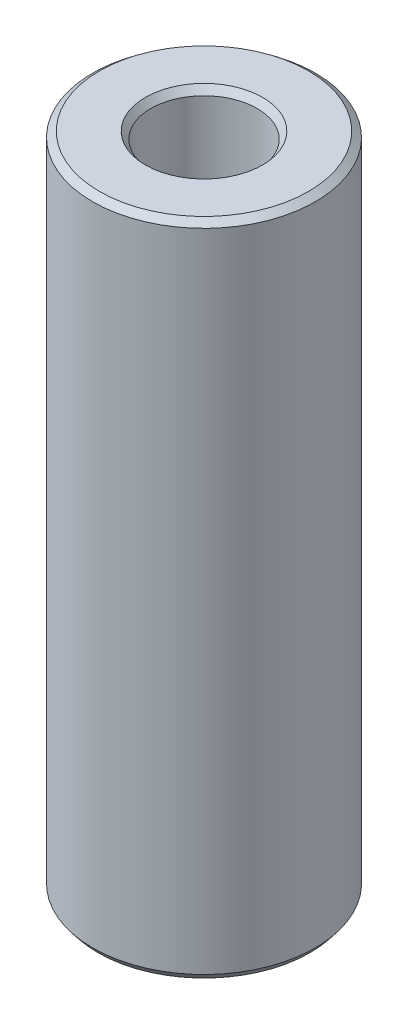
from build123d import *
from OCP.BRepFilletAPI import BRepFilletAPI_MakeChamfer

# Parameters (mm, degrees)
SKETCH1_R           = 57.5
BOSS_EXTRUDE1_DEPTH = 339.91790839
SKETCH2_R           = 27.460702614
CUT_EXTRUDE1_DEPTH  = 350.509205092
CHAMFER1_SIZE       = 2.786394633
CHAMFER1_SIZE2      = 3.574376344


with BuildPart() as part:
    # Sketch1 → Boss-Extrude1 (new body)
    with BuildSketch(Plane(origin=(0, 0, 0), x_dir=(1, 0, 0), z_dir=(0, 1, 0))):
        Circle(SKETCH1_R)
    extrude(amount=BOSS_EXTRUDE1_DEPTH)

    # Sketch2 → Cut-Extrude1 (cut, through all)
    with BuildSketch(Plane(origin=(0, 0, 0), x_dir=(1, 0, 0), z_dir=(0, 1, 0))):
        Circle(SKETCH2_R)
    extrude(amount=CUT_EXTRUDE1_DEPTH, mode=Mode.SUBTRACT)

    # Chamfer1: one chamfer whose edges measure the first distance from different faces: ONE call of the kernel's chamfer builder (chamfer() names one face for all edges)
    chamfer1_edges_1 = [part.edges().sort_by_distance(p)[0] for p in [
        (-27.460702614, 339.91790839, 0),
    ]]
    chamfer1_side_1 = [part.faces().sort_by_distance(p)[0] for p in [
        (-55.873654403, 339.91790839, 0),
    ]]
    chamfer1_edges_2 = [part.edges().sort_by_distance(p)[0] for p in [
        (-27.460702614, 0, 0),
    ]]
    chamfer1_side_2 = [part.faces().sort_by_distance(p)[0] for p in [
        (-27.460702614, 169.958954195, 0),
    ]]
    chamfer1_edges_3 = [part.edges().sort_by_distance(p)[0] for p in [
        (-57.5, 0, 0),
    ]]
    chamfer1_side_3 = [part.faces().sort_by_distance(p)[0] for p in [
        (-55.873654403, 0, 0),
    ]]
    chamfer1_edges_4 = [part.edges().sort_by_distance(p)[0] for p in [
        (-57.5, 339.91790839, 0),
    ]]
    chamfer1_side_4 = [part.faces().sort_by_distance(p)[0] for p in [
        (-57.5, 169.958954195, 0),
    ]]
    chamfer1 = BRepFilletAPI_MakeChamfer(part.part.solid().wrapped)
    for e in chamfer1_edges_1:
        chamfer1.Add(CHAMFER1_SIZE, CHAMFER1_SIZE2, e.wrapped, chamfer1_side_1[0].wrapped)  # the first distance lies on this face
    for e in chamfer1_edges_2:
        chamfer1.Add(CHAMFER1_SIZE, CHAMFER1_SIZE2, e.wrapped, chamfer1_side_2[0].wrapped)  # the first distance lies on this face
    for e in chamfer1_edges_3:
        chamfer1.Add(CHAMFER1_SIZE, CHAMFER1_SIZE2, e.wrapped, chamfer1_side_3[0].wrapped)  # the first distance lies on this face
    for e in chamfer1_edges_4:
        chamfer1.Add(CHAMFER1_SIZE, CHAMFER1_SIZE2, e.wrapped, chamfer1_side_4[0].wrapped)  # the first distance lies on this face
    add(Compound.cast(chamfer1.Shape()), mode=Mode.REPLACE)


solid = part.part
